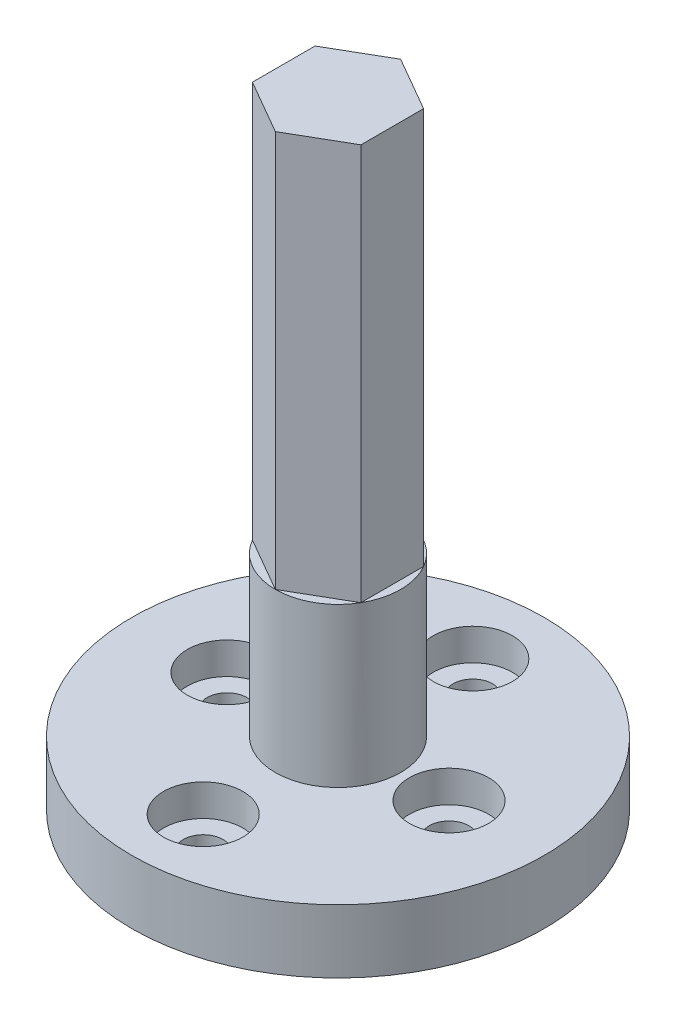
from build123d import *

# Parameters (mm, degrees)
CROQUIS3_R                 = 13
SALIENTE_EXTRUIR1_DEPTH    = 4
CROQUIS4_R                 = 3.95
SALIENTE_EXTRUIR2_DEPTH    = 35
CORTAR_EXTRUIR3_DEPTH      = 44.116122275
CORTAR_EXTRUIR3_DEPTH_BACK = 44.116122275
CROQUIS8_R                 = 1.25
CORTAR_EXTRUIR5_DEPTH      = 40.534794802
CORTAR_EXTRUIR5_DEPTH_BACK = 2
CROQUIS10_R                = 2.5
CROQUIS10_R_2              = 1.25
CROQUIS9_R                 = 1.625
CORTAR_EXTRUIR4_DEPTH      = 3
CROQUIS11_R                = 4
CORTAR_EXTRUIR6_DEPTH      = 0.5
CROQUIS12_OUTSIDE_W        = 38.72
CROQUIS12_OUTSIDE_H        = 38.72
CORTAR_EXTRUIR7_DEPTH      = 25


with BuildPart() as part:
    # Croquis3 → Saliente-Extruir1 (new body)
    with BuildSketch(Plane(origin=(0, 0, 0), x_dir=(1, 0, 0), z_dir=(0, 1, 0))):
        Circle(CROQUIS3_R)
    extrude(amount=SALIENTE_EXTRUIR1_DEPTH)

    # Croquis4 → Saliente-Extruir2 (add)
    with BuildSketch(Plane(origin=(0, 4, 0), x_dir=(1, 0, 0), z_dir=(0, 1, 0))):
        Circle(CROQUIS4_R)
    extrude(amount=SALIENTE_EXTRUIR2_DEPTH)

    # Croquis8 → Cortar-Extruir3 (cut, two sides: drawn at the far end of the back side and taken through both)
    with BuildSketch(Plane.XZ.offset(-CORTAR_EXTRUIR3_DEPTH_BACK)):
        with Locations((0, 8.5)):
            Circle(CROQUIS8_R)
        with Locations((0, -8.5)):
            Circle(CROQUIS8_R)
        with Locations((-7, 0)):
            Circle(CROQUIS8_R)
        with Locations((7, 0)):
            Circle(CROQUIS8_R)
    extrude(amount=CORTAR_EXTRUIR3_DEPTH + CORTAR_EXTRUIR3_DEPTH_BACK, mode=Mode.SUBTRACT)

    # Croquis10 → Cortar-Extruir5 (cut, two sides: drawn at the far end of the back side and taken through both)
    # profile 1 of 4: a face of its own
    with BuildSketch(Plane(origin=(0, 4, 0), x_dir=(1, 0, 0), z_dir=(0, 1, 0)).offset(-CORTAR_EXTRUIR5_DEPTH_BACK)):
        with Locations((0, 8.5)):
            Circle(CROQUIS10_R)
    # profile 2 of 4: a face of its own
    with BuildSketch(Plane(origin=(0, 4, 0), x_dir=(1, 0, 0), z_dir=(0, 1, 0)).offset(-CORTAR_EXTRUIR5_DEPTH_BACK)):
        with Locations((0, -8.5)):
            Circle(CROQUIS10_R)
    # profile 3 of 4: a face of its own
    with BuildSketch(Plane(origin=(0, 4, 0), x_dir=(1, 0, 0), z_dir=(0, 1, 0)).offset(-CORTAR_EXTRUIR5_DEPTH_BACK)):
        with Locations((-7, 0)):
            Circle(CROQUIS10_R)
        with Locations((-7, 0)):
            Circle(CROQUIS10_R_2, mode=Mode.SUBTRACT)
    # profile 4 of 4: a face of its own
    with BuildSketch(Plane(origin=(0, 4, 0), x_dir=(1, 0, 0), z_dir=(0, 1, 0)).offset(-CORTAR_EXTRUIR5_DEPTH_BACK)):
        with Locations((7, 0)):
            Circle(CROQUIS10_R)
        with Locations((7, 0)):
            Circle(CROQUIS10_R_2, mode=Mode.SUBTRACT)
    extrude(amount=CORTAR_EXTRUIR5_DEPTH + CORTAR_EXTRUIR5_DEPTH_BACK, mode=Mode.SUBTRACT)

    # Croquis9 → Cortar-Extruir4 (cut)
    with BuildSketch(Plane(origin=(0, 0, 0), x_dir=(1, 0, 0), z_dir=(0, 1, 0))):
        Circle(CROQUIS9_R)
    extrude(amount=CORTAR_EXTRUIR4_DEPTH, mode=Mode.SUBTRACT)

    # Croquis11 → Cortar-Extruir6 (cut)
    with BuildSketch(Plane.XZ):
        Circle(CROQUIS11_R)
    extrude(amount=-CORTAR_EXTRUIR6_DEPTH, mode=Mode.SUBTRACT)

    # Croquis12 outside → Cortar-Extruir7 (cut)
    with BuildSketch(Plane(origin=(0, 39, 0), x_dir=(1, 0, 0), z_dir=(0, 1, 0))):
        Rectangle(CROQUIS12_OUTSIDE_W, CROQUIS12_OUTSIDE_H)
        Polygon((0, 3.95), (-3.420800345, 1.975), (-3.420800345, -1.975), (0, -3.95), (3.420800345, -1.975), (3.420800345, 1.975), align=None, mode=Mode.SUBTRACT)
    extrude(amount=-CORTAR_EXTRUIR7_DEPTH, mode=Mode.SUBTRACT)


solid = part.part
